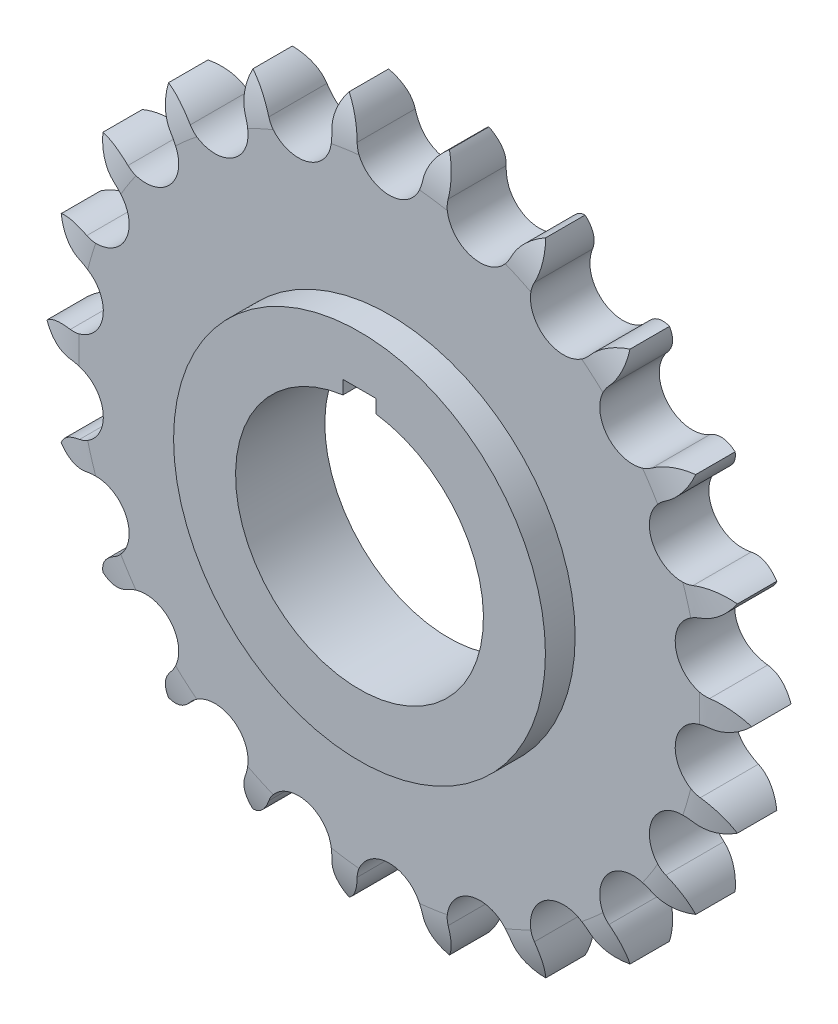
from build123d import *

# Parameters (mm, degrees)
SALIENTE_EXTRUIR3_START = -3.6
SALIENTE_EXTRUIR3_DEPTH = 7.2
CROQUIS6_R              = 22.5
SALIENTE_EXTRUIR4_DEPTH = 3.6
CORTAR_EXTRUIR2_DEPTH   = 61.427918097


# Read off the part's stored shape, not the designer's step: Saliente-Extruir3
with BuildPart() as part:
    # Saliente-Extruir3 outline → Saliente-Extruir3 (new body)
    with BuildSketch(Plane.XY.offset(SALIENTE_EXTRUIR3_START)):
        with BuildLine():
            ThreePointArc((-6.068455148, 42.207032212), (-6.967174737, 40.235125402), (-7.040586024, 38.069317436))
            ThreePointArc((-7.040586024, 38.069317436), (-9.86063949, 33.582254077), (-14.658909033, 35.832375969))
            ThreePointArc((-14.658909033, 35.832375969), (-15.891590726, 37.614680434), (-17.713735065, 38.78766951))
            ThreePointArc((-17.713735065, 38.78766951), (-18.020499896, 36.642438988), (-17.480758959, 34.543680288))
            ThreePointArc((-17.480758959, 34.543680288), (-18.922428611, 29.443873649), (-24.160267117, 30.251021048))
            ThreePointArc((-24.160267117, 30.251021048), (-25.845149735, 31.613843094), (-27.923953637, 32.225960487))
            ThreePointArc((-27.923953637, 32.225960487), (-27.613911057, 30.081201234), (-26.504744765, 28.219519602))
            ThreePointArc((-26.504744765, 28.219519602), (-26.451235102, 22.920125688), (-31.704304046, 22.218908311))
            ThreePointArc((-31.704304046, 22.218908311), (-33.704888419, 23.0518402), (-35.871939555, 23.0534958))
            ThreePointArc((-35.871939555, 23.0534958), (-34.970207369, 21.082963456), (-33.381473779, 19.609181266))
            ThreePointArc((-33.381473779, 19.609181266), (-31.837119837, 14.539525455), (-36.679846815, 12.386751764))
            ThreePointArc((-36.679846815, 12.386751764), (-38.834057494, 12.622314309), (-40.913794268, 12.013373988))
            ThreePointArc((-40.913794268, 12.013373988), (-39.493425457, 10.376709363), (-37.553834316, 9.410223684))
            ThreePointArc((-37.553834316, 9.410223684), (-34.643750466, 4.98101934), (-38.683806537, 1.551094256))
            ThreePointArc((-38.683806537, 1.551094256), (-40.817122186, 1.17020358), (-42.641056694, 6.1e-08))
            ThreePointArc((-42.641056694, 6.1e-08), (-40.81712109, -1.170204009), (-38.683806537, -1.551094256))
            ThreePointArc((-38.683806537, -1.551094256), (-34.643750466, -4.98101934), (-37.553834316, -9.410223684))
            ThreePointArc((-37.553834316, -9.410223684), (-39.493426387, -10.376710084), (-40.913794303, -12.01337387))
            ThreePointArc((-40.913794303, -12.01337387), (-38.834056322, -12.622314412), (-36.679846815, -12.386751764))
            ThreePointArc((-36.679846815, -12.386751764), (-31.837119837, -14.539525455), (-33.381473779, -19.609181266))
            ThreePointArc((-33.381473779, -19.609181266), (-34.970208059, -21.082964409), (-35.871939621, -23.053495697))
            ThreePointArc((-35.871939621, -23.053495697), (-33.704887265, -23.051839969), (-31.704304046, -22.218908311))
            ThreePointArc((-31.704304046, -22.218908311), (-26.451235102, -22.920125688), (-26.504744765, -28.219519602))
            ThreePointArc((-26.504744765, -28.219519602), (-27.61391145, -30.081202344), (-27.923953729, -32.225960407))
            ThreePointArc((-27.923953729, -32.225960407), (-25.845148693, -31.613842547), (-24.160267117, -30.251021048))
            ThreePointArc((-24.160267117, -30.251021048), (-18.922428611, -29.443873649), (-17.480758959, -34.543680288))
            ThreePointArc((-17.480758959, -34.543680288), (-18.020499961, -36.642440163), (-17.713735177, -38.787669459))
            ThreePointArc((-17.713735177, -38.787669459), (-15.891589881, -37.614679616), (-14.658909033, -35.832375969))
            ThreePointArc((-14.658909033, -35.832375969), (-9.86063949, -33.582254077), (-7.040586024, -38.069317436))
            ThreePointArc((-7.040586024, -38.069317436), (-6.967174737, -40.235125402), (-6.068455148, -42.207032212))
            ThreePointArc((-6.068455148, -42.207032212), (-4.650588967, -40.568199045), (-3.969973318, -38.510804892))
            ThreePointArc((-3.969973318, -38.510804892), (0, -35), (3.969973318, -38.510804892))
            ThreePointArc((3.969973318, -38.510804892), (4.650589548, -40.568200069), (6.068455027, -42.207032229))
            ThreePointArc((6.068455027, -42.207032229), (6.967175006, -40.235124257), (7.040586024, -38.069317436))
            ThreePointArc((7.040586024, -38.069317436), (9.86063949, -33.582254077), (14.658909033, -35.832375969))
            ThreePointArc((14.658909033, -35.832375969), (15.891590726, -37.614680434), (17.713735065, -38.78766951))
            ThreePointArc((17.713735065, -38.78766951), (18.020499896, -36.642438988), (17.480758959, -34.543680288))
            ThreePointArc((17.480758959, -34.543680288), (18.922428611, -29.443873649), (24.160267117, -30.251021048))
            ThreePointArc((24.160267117, -30.251021048), (25.845149735, -31.613843094), (27.923953637, -32.225960487))
            ThreePointArc((27.923953637, -32.225960487), (27.613911057, -30.081201234), (26.504744765, -28.219519602))
            ThreePointArc((26.504744765, -28.219519602), (26.451235102, -22.920125688), (31.704304046, -22.218908311))
            ThreePointArc((31.704304046, -22.218908311), (33.704888419, -23.0518402), (35.871939555, -23.0534958))
            ThreePointArc((35.871939555, -23.0534958), (34.970207369, -21.082963456), (33.381473779, -19.609181266))
            ThreePointArc((33.381473779, -19.609181266), (31.837119837, -14.539525455), (36.679846815, -12.386751764))
            ThreePointArc((36.679846815, -12.386751764), (38.834057494, -12.622314309), (40.913794268, -12.013373988))
            ThreePointArc((40.913794268, -12.013373988), (39.493425457, -10.376709363), (37.553834316, -9.410223684))
            ThreePointArc((37.553834316, -9.410223684), (34.643750466, -4.98101934), (38.683806537, -1.551094256))
            ThreePointArc((38.683806537, -1.551094256), (40.817122186, -1.17020358), (42.641056694, -6.1e-08))
            ThreePointArc((42.641056694, -6.1e-08), (40.81712109, 1.170204009), (38.683806537, 1.551094256))
            ThreePointArc((38.683806537, 1.551094256), (34.643750466, 4.98101934), (37.553834316, 9.410223684))
            ThreePointArc((37.553834316, 9.410223684), (39.493426387, 10.376710084), (40.913794303, 12.01337387))
            ThreePointArc((40.913794303, 12.01337387), (38.834056322, 12.622314412), (36.679846815, 12.386751764))
            ThreePointArc((36.679846815, 12.386751764), (31.837119837, 14.539525455), (33.381473779, 19.609181266))
            ThreePointArc((33.381473779, 19.609181266), (34.970208059, 21.082964409), (35.871939621, 23.053495697))
            ThreePointArc((35.871939621, 23.053495697), (33.704887265, 23.051839969), (31.704304046, 22.218908311))
            ThreePointArc((31.704304046, 22.218908311), (26.451235102, 22.920125688), (26.504744765, 28.219519602))
            ThreePointArc((26.504744765, 28.219519602), (27.61391145, 30.081202344), (27.923953729, 32.225960407))
            ThreePointArc((27.923953729, 32.225960407), (25.845148693, 31.613842547), (24.160267117, 30.251021048))
            ThreePointArc((24.160267117, 30.251021048), (18.922428611, 29.443873649), (17.480758959, 34.543680288))
            ThreePointArc((17.480758959, 34.543680288), (18.020499961, 36.642440163), (17.713735177, 38.787669459))
            ThreePointArc((17.713735177, 38.787669459), (15.891589881, 37.614679616), (14.658909033, 35.832375969))
            ThreePointArc((14.658909033, 35.832375969), (9.86063949, 33.582254077), (7.040586024, 38.069317436))
            ThreePointArc((7.040586024, 38.069317436), (6.967174737, 40.235125402), (6.068455148, 42.207032212))
            ThreePointArc((6.068455148, 42.207032212), (4.650588967, 40.568199045), (3.969973318, 38.510804892))
            ThreePointArc((3.969973318, 38.510804892), (0, 35), (-3.969973318, 38.510804892))
            ThreePointArc((-3.969973318, 38.510804892), (-4.650588967, 40.568199045), (-6.068455148, 42.207032212))
        make_face()
    extrude(amount=SALIENTE_EXTRUIR3_DEPTH)

    # Croquis6 → Saliente-Extruir4 (add, symmetric)
    with BuildSketch(Plane.XY.offset(3.6)):
        Circle(CROQUIS6_R)
        with BuildLine():
            Line((-2, 14.866068747), (-2, 16.5))
            Line((-2, 16.5), (2, 16.5))
            Line((2, 16.5), (2, 14.866068747))
            ThreePointArc((2, 14.866068747), (0, -15), (-2, 14.866068747))
        make_face(mode=Mode.SUBTRACT)
    extrude(amount=SALIENTE_EXTRUIR4_DEPTH, both=True)

    # Croquis7 → Cortar-Extruir2 (cut, through all)
    with BuildSketch(Plane.XY.offset(3.6)):
        with BuildLine():
            Line((2, 14.866068747), (2, 16.5))
            Line((2, 16.5), (-2, 16.5))
            Line((-2, 16.5), (-2, 14.866068747))
            ThreePointArc((-2, 14.866068747), (0, -15), (2, 14.866068747))
        make_face()
    extrude(amount=-CORTAR_EXTRUIR2_DEPTH, mode=Mode.SUBTRACT)

    # Croquis5 → Cortar-Revolución2 (revolve, cut)
    with BuildSketch(Plane(origin=(0, 0, 0), x_dir=(0, 0, -1), z_dir=(1, 0, 0))):
        with BuildLine():
            Line((-2.1, 43.207030785), (-11.689772971, 43.207030785))
            Line((-11.689772971, 43.207030785), (-11.689772971, 36.857030785))
            Line((-11.689772971, 36.857030785), (-3.6, 36.857030785))
            ThreePointArc((-3.6, 36.857030785), (-3.26475648, 40.130004756), (-2.1, 43.207030785))
        make_face()
        with BuildLine():
            Line((11.689772971, 36.857030785), (3.6, 36.857030785))
            ThreePointArc((3.6, 36.857030785), (3.26475648, 40.130004756), (2.1, 43.207030785))
            Line((2.1, 43.207030785), (11.689772971, 43.207030785))
            Line((11.689772971, 43.207030785), (11.689772971, 36.857030785))
        make_face()
    revolve(axis=Axis((0, 0, 7.2), (0, 0, -1)), mode=Mode.SUBTRACT)


solid = part.part
